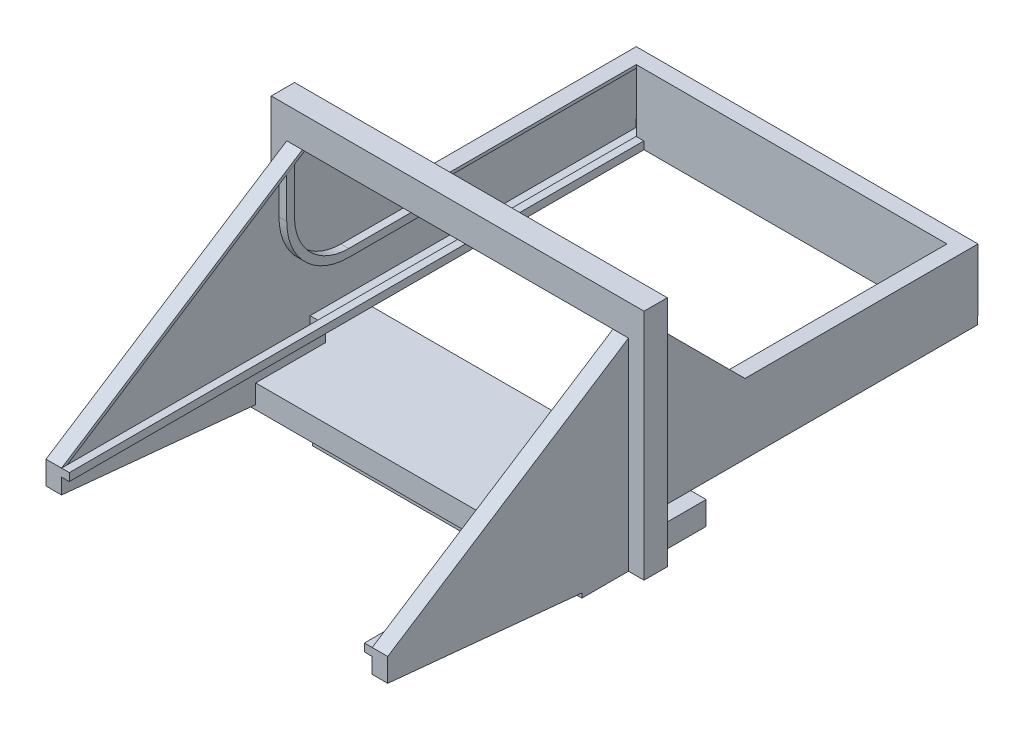
from build123d import *

# Parameters (mm, degrees)
CROQUIS2_W               = 15
CROQUIS2_H               = 150
SALIENTE_EXTRUIR1_DEPTH  = 10
SALIENTE_EXTRUIR2_DEPTH  = 10
CROQUIS5_W               = 15
CROQUIS5_H               = 15
CROQUIS5_H_2             = 20
CROQUIS5_W_2             = 10
CROQUIS5_H_3             = 45.004018959
SALIENTE_EXTRUIR3_DEPTH  = 100
CROQUIS6_W               = 369.884378223
CROQUIS6_H               = 5
SALIENTE_EXTRUIR6_DEPTH  = 5
VACIADO1_START           = 12
VACIADO1_OUTLINE_W       = 11
VACIADO1_OUTLINE_H       = 11
VACIADO1_DEPTH           = 8
VACIADO1_START_2         = 20
VACIADO1_2_OUTLINE_W     = 16
VACIADO1_2_OUTLINE_H     = 11
VACIADO1_2_OUTLINE_W_2   = 11
VACIADO1_2_DEPTH         = 98
VACIADO1_3_DEPTH         = 6
VACIADO1_START_3         = 2
VACIADO1_4_OUTLINE_W     = 146
VACIADO1_4_OUTLINE_H     = 11
VACIADO1_4_DEPTH         = 10
VACIADO1_5_OUTLINE_W     = 1
VACIADO1_5_OUTLINE_H     = 365.884378223
VACIADO1_5_DEPTH         = 3
VACIADO1_START_4         = 22
VACIADO1_6_DEPTH         = 96
SALIENTE_EXTRUIR7_DEPTH  = 5
CROQUIS8_W               = 15
CROQUIS8_H               = 150
SALIENTE_EXTRUIR8_DEPTH  = 10
SIMETR_A8_START          = 228
SIMETR_A8_DEPTH          = 2
SIMETR_A8_START_2        = 120
SIMETR_A8_2_OUTLINE_W    = 20
SIMETR_A8_2_OUTLINE_H    = 15
SIMETR_A8_2_OUTLINE_W_2  = 16
SIMETR_A8_2_OUTLINE_H_2  = 11
SIMETR_A8_2_OUTLINE_W_3  = 15
SIMETR_A8_2_OUTLINE_W_4  = 11
SIMETR_A8_2_OUTLINE_W_5  = 45.004018959
SIMETR_A8_2_OUTLINE_H_3  = 10
SIMETR_A8_2_OUTLINE_W_6  = 41.004018959
SIMETR_A8_2_OUTLINE_H_4  = 6
SIMETR_A8_2_DEPTH        = 100
SIMETR_A8_START_3        = 230
SIMETR_A8_3_OUTLINE_W    = 150
SIMETR_A8_3_OUTLINE_H    = 15
SIMETR_A8_3_DEPTH        = 10
SIMETR_A8_START_4        = 220
SIMETR_A8_4_DEPTH        = 8
SIMETR_A8_START_5        = 215
SIMETR_A8_5_OUTLINE_W    = 5
SIMETR_A8_5_OUTLINE_H    = 369.884378223
SIMETR_A8_5_OUTLINE_W_2  = 1
SIMETR_A8_5_OUTLINE_H_2  = 365.884378223
SIMETR_A8_5_DEPTH        = 5
SIMETR_A8_6_DEPTH        = 2
SIMETR_A8_7_OUTLINE_W    = 16
SIMETR_A8_7_OUTLINE_H    = 11
SIMETR_A8_7_OUTLINE_W_2  = 11
SIMETR_A8_7_OUTLINE_W_3  = 41.004018959
SIMETR_A8_7_OUTLINE_H_2  = 6
SIMETR_A8_7_DEPTH        = 2
SIMETR_A8_8_OUTLINE_W    = 1
SIMETR_A8_8_OUTLINE_H    = 365.884378223
SIMETR_A8_8_DEPTH        = 2
SIMETR_A8_START_6        = 218
SIMETR_A8_9_DEPTH        = 2
SALIENTE_EXTRUIR9_DEPTH  = 5
CROQUIS10_W              = 220
CROQUIS10_H              = 80
SALIENTE_EXTRUIR10_DEPTH = 15
CROQUIS11_W              = 7
CROQUIS11_H              = 1
SALIENTE_EXTRUIR11_DEPTH = 7
CROQUIS12_R              = 2.5
CORTAR_EXTRUIR1_DEPTH    = 351.399583266
CROQUIS13_W              = 137.06677635
CROQUIS13_H              = 7
SALIENTE_EXTRUIR13_DEPTH = 1
CROQUIS14_W              = 136.928381549
CROQUIS14_H              = 7
SALIENTE_EXTRUIR14_DEPTH = 1
CROQUIS15_W              = 144.06677635
CROQUIS15_H              = 1
SALIENTE_EXTRUIR15_DEPTH = 7


# Read off the part's stored shape, not the designer's step: Vaciado1, Simetría8
with BuildPart() as part:
    # Croquis2 → Saliente-Extruir1 (new body)
    with BuildSketch(Plane(origin=(0, 0, 0), x_dir=(0, 0, -1), z_dir=(1, 0, 0))):
        Rectangle(CROQUIS2_W, CROQUIS2_H)
    extrude(amount=SALIENTE_EXTRUIR1_DEPTH)

    # Croquis3 → Saliente-Extruir2 (add)
    with BuildSketch(Plane(origin=(10, 0, 0), x_dir=(0, 0, -1), z_dir=(1, 0, 0))):
        Polygon((-7.5, -75), (-162.5, -60), (-162.5, -45), (-7.5, 55), (-7.5, 75), (7.5, 75), (7.5, 55), (67.5, -5), (217.5, -5), (217.5, -45), (217.230368445, -45), (217.230368445, -50), (7.5, -50), (7.5, -75), align=None)
    extrude(amount=SALIENTE_EXTRUIR2_DEPTH)

    # Croquis5 → Saliente-Extruir3 (add)
    with BuildSketch(Plane(origin=(20, 0, 0), x_dir=(0, 0, -1), z_dir=(1, 0, 0))):
        with Locations((0, -67.5)):
            Rectangle(CROQUIS5_W, CROQUIS5_H)
        with Locations((0, 65)):
            Rectangle(CROQUIS5_W, CROQUIS5_H_2)
        with Locations((212.5, -27.502009479)):
            Rectangle(CROQUIS5_W_2, CROQUIS5_H_3)
    extrude(amount=SALIENTE_EXTRUIR3_DEPTH)

    # Croquis6 → Saliente-Extruir6 (add)
    with BuildSketch(Plane(origin=(20, 0, 0), x_dir=(0, 0, -1), z_dir=(1, 0, 0))):
        with Locations((22.442189111, -47.5)):
            Rectangle(CROQUIS6_W, CROQUIS6_H)
    extrude(amount=SALIENTE_EXTRUIR6_DEPTH)

    # Vaciado1 outline → Vaciado1 (cut)
    with BuildSketch(Plane.YZ.offset(VACIADO1_START)):
        Polygon((73, -5.5), (73, 5.5), (53.910210742, 5.5), (-46.089789258, 160.5), (-48, 160.5), (-48, -215.230368445), (-43, -215.230368445), (-43, -215.5), (-7, -215.5), (-7, -66.671572875), (54.171572875, -5.5), align=None)
        with Locations((-67.5, 0)):
            Rectangle(VACIADO1_OUTLINE_W, VACIADO1_OUTLINE_H)
    extrude(amount=VACIADO1_DEPTH, mode=Mode.SUBTRACT)

    # Vaciado1 2 outline → Vaciado1 2 (cut)
    with BuildSketch(Plane.YZ.offset(VACIADO1_START_2)):
        with Locations((65, 0)):
            Rectangle(VACIADO1_2_OUTLINE_W, VACIADO1_2_OUTLINE_H)
        Polygon((-7, -215.5), (-7, -209.5), (-48, -209.5), (-48, -215.230368445), (-43, -215.230368445), (-43, -215.5), align=None)
        with Locations((-67.5, 0)):
            Rectangle(VACIADO1_2_OUTLINE_W_2, VACIADO1_2_OUTLINE_H)
    extrude(amount=VACIADO1_2_DEPTH, mode=Mode.SUBTRACT)

    # Vaciado1 3 outline → Vaciado1 3 (cut)
    with BuildSketch(Plane.YZ.offset(VACIADO1_START)):
        Polygon((-62, -5.5), (-48, -5.5), (-48, 160.5), (-58.184204967, 160.5), (-73, 7.40345133), (-73, 5.5), (-62, 5.5), align=None)
    extrude(amount=VACIADO1_3_DEPTH, mode=Mode.SUBTRACT)

    # Vaciado1 4 outline → Vaciado1 4 (cut)
    with BuildSketch(Plane.YZ.offset(VACIADO1_START_3)):
        Rectangle(VACIADO1_4_OUTLINE_W, VACIADO1_4_OUTLINE_H)
    extrude(amount=VACIADO1_4_DEPTH, mode=Mode.SUBTRACT)

    # Vaciado1 5 outline → Vaciado1 5 (cut)
    with BuildSketch(Plane.YZ.offset(VACIADO1_START_2)):
        with Locations((-47.5, -22.442189111)):
            Rectangle(VACIADO1_5_OUTLINE_W, VACIADO1_5_OUTLINE_H)
    extrude(amount=VACIADO1_5_DEPTH, mode=Mode.SUBTRACT)

    # Vaciado1 6 outline → Vaciado1 6 (cut)
    with BuildSketch(Plane.YZ.offset(VACIADO1_START_4)):
        Polygon((-48, -215.230368445), (-48, -209.5), (-48.004018959, -209.5), (-48.004018959, -215.5), (-43, -215.5), (-43, -215.230368445), align=None)
    extrude(amount=VACIADO1_6_DEPTH, mode=Mode.SUBTRACT)

    # Croquis8 → Saliente-Extruir8 (add)
    with BuildSketch(Plane(origin=(12, 0, 0), x_dir=(0, 0, -1), z_dir=(1, 0, 0))):
        Rectangle(CROQUIS8_W, CROQUIS8_H)
    extrude(amount=-SALIENTE_EXTRUIR8_DEPTH)

    # Simetr_a8 2 outline → Simetr_a8 2 (add)
    # profile 1 of 3: a face of its own
    with BuildSketch(Plane.YZ.offset(SIMETR_A8_START_2)):
        with Locations((65, 0)):
            Rectangle(SIMETR_A8_2_OUTLINE_W, SIMETR_A8_2_OUTLINE_H)
        with Locations((65, 0)):
            Rectangle(SIMETR_A8_2_OUTLINE_W_2, SIMETR_A8_2_OUTLINE_H_2, mode=Mode.SUBTRACT)
    # profile 2 of 3: a face of its own
    with BuildSketch(Plane.YZ.offset(SIMETR_A8_START_2)):
        with Locations((-67.5, 0)):
            Rectangle(SIMETR_A8_2_OUTLINE_W_3, SIMETR_A8_2_OUTLINE_H)
        with Locations((-67.5, 0)):
            Rectangle(SIMETR_A8_2_OUTLINE_W_4, SIMETR_A8_2_OUTLINE_H_2, mode=Mode.SUBTRACT)
    # profile 3 of 3: a face of its own
    with BuildSketch(Plane.YZ.offset(SIMETR_A8_START_2)):
        with Locations((-27.502009479, -212.5)):
            Rectangle(SIMETR_A8_2_OUTLINE_W_5, SIMETR_A8_2_OUTLINE_H_3)
        with Locations((-27.502009479, -212.5)):
            Rectangle(SIMETR_A8_2_OUTLINE_W_6, SIMETR_A8_2_OUTLINE_H_4, mode=Mode.SUBTRACT)
    extrude(amount=SIMETR_A8_2_DEPTH)



with BuildPart() as body_2:
    # Croquis7 → Saliente-Extruir7 (new body)
    with BuildSketch(Plane(origin=(20, 0, 0), x_dir=(0, 0, -1), z_dir=(1, 0, 0))):
        with BuildLine():
            Line((-17.511578112, 20), (-17.511578112, 48.540917347))
            Line((-17.511578112, 48.540917347), (-12.511578112, 51.766723799))
            Line((-12.511578112, 51.766723799), (-12.511578112, 20))
            ThreePointArc((-12.511578112, 20), (-2.276657661, -4.732396988), (22.442189111, -15))
            Line((22.442189111, -15), (67.5, -15))
            Line((67.5, -15), (67.5, -20))
            Line((67.5, -20), (22.488421888, -20))
            ThreePointArc((22.488421888, -20), (-5.795849359, -8.284271247), (-17.511578112, 20))
        make_face()
    extrude(amount=-SALIENTE_EXTRUIR7_DEPTH)


with BuildPart() as body_3:
    # Simetría8 outline → Simetría8 (new body)
    with BuildSketch(Plane.YZ.offset(SIMETR_A8_START)):
        Polygon((-45, 162.5), (-60, 162.5), (-75, 7.5), (-75, -7.5), (-50, -7.5), (-50, -217.230368445), (-45, -217.230368445), (-45, -217.5), (-5, -217.5), (-5, -67.5), (55, -7.5), (75, -7.5), (75, 7.5), (55, 7.5), align=None)
    extrude(amount=SIMETR_A8_DEPTH)

    # Simetr_a8 3 outline → Simetr_a8 3 (add)
    with BuildSketch(Plane.YZ.offset(SIMETR_A8_START_3)):
        Rectangle(SIMETR_A8_3_OUTLINE_W, SIMETR_A8_3_OUTLINE_H)
    extrude(amount=SIMETR_A8_3_DEPTH)


with BuildPart() as part_1:
    add(part.part)

    add(body_3.part)  # Simetr_a8 4 merges body 3
    # Simetr_a8 4 outline → Simetr_a8 4 (add)
    with BuildSketch(Plane.YZ.offset(SIMETR_A8_START_4)):
        Polygon((-45, 162.5), (-60, 162.5), (-75, 7.5), (-75, -7.5), (-50, -7.5), (-50, -217.230368445), (-45, -217.230368445), (-45, -217.5), (-5, -217.5), (-5, -67.5), (55, -7.5), (75, -7.5), (75, 7.5), (55, 7.5), align=None)
        Polygon((-46.089789258, 160.5), (53.910210742, 5.5), (73, 5.5), (73, -5.5), (54.171572875, -5.5), (-7, -66.671572875), (-7, -215.5), (-43, -215.5), (-43, -215.230368445), (-48, -215.230368445), (-48, -5.5), (-73, -5.5), (-73, 7.40345133), (-58.184204967, 160.5), align=None, mode=Mode.SUBTRACT)
    extrude(amount=SIMETR_A8_4_DEPTH)

    # Simetr_a8 5 outline → Simetr_a8 5 (add)
    with BuildSketch(Plane.YZ.offset(SIMETR_A8_START_5)):
        with Locations((-47.5, -22.442189111)):
            Rectangle(SIMETR_A8_5_OUTLINE_W, SIMETR_A8_5_OUTLINE_H)
        with Locations((-47.5, -22.442189111)):
            Rectangle(SIMETR_A8_5_OUTLINE_W_2, SIMETR_A8_5_OUTLINE_H_2, mode=Mode.SUBTRACT)
    extrude(amount=SIMETR_A8_5_DEPTH)

    # Simetr_a8 6 outline → Simetr_a8 6 (add)
    with BuildSketch(Plane.YZ.offset(SIMETR_A8_START_4)):
        Polygon((-48, 160.5), (-58.184204967, 160.5), (-73, 7.40345133), (-73, 5.5), (-62, 5.5), (-62, -5.5), (-48, -5.5), align=None)
    extrude(amount=SIMETR_A8_6_DEPTH)

    # Simetr_a8 7 outline → Simetr_a8 7 (add)
    with BuildSketch(Plane.YZ.offset(SIMETR_A8_START_2)):
        with Locations((65, 0)):
            Rectangle(SIMETR_A8_7_OUTLINE_W, SIMETR_A8_7_OUTLINE_H)
        with Locations((-67.5, 0)):
            Rectangle(SIMETR_A8_7_OUTLINE_W_2, SIMETR_A8_7_OUTLINE_H)
        with Locations((-27.502009479, -212.5)):
            Rectangle(SIMETR_A8_7_OUTLINE_W_3, SIMETR_A8_7_OUTLINE_H_2)
    extrude(amount=SIMETR_A8_7_DEPTH)

    # Simetr_a8 8 outline → Simetr_a8 8 (add)
    with BuildSketch(Plane.YZ.offset(SIMETR_A8_START_5)):
        with Locations((-47.5, -22.442189111)):
            Rectangle(SIMETR_A8_8_OUTLINE_W, SIMETR_A8_8_OUTLINE_H)
    extrude(amount=SIMETR_A8_8_DEPTH)

    # Simetr_a8 9 outline → Simetr_a8 9 (add)
    with BuildSketch(Plane.YZ.offset(SIMETR_A8_START_6)):
        Polygon((-48, -215.230368445), (-48, -209.5), (-48.004018959, -209.5), (-48.004018959, -215.5), (-43, -215.5), (-43, -215.230368445), align=None)
    extrude(amount=SIMETR_A8_9_DEPTH)

    # Croquis9 → Saliente-Extruir9 (add)
    with BuildSketch(Plane.ZY.offset(-228)):
        with BuildLine():
            Line((-67.5, -25), (-22.49, -25))
            ThreePointArc((-22.49, -25), (5.794271247, -13.284271247), (17.51, 15))
            Line((17.51, 15), (17.511578112, 48.540917347))
            Line((17.511578112, 48.540917347), (12.51, 51.767741935))
            Line((12.51, 51.767741935), (12.51, 15))
            ThreePointArc((12.51, 15), (2.258737342, -9.748737342), (-22.49, -20))
            Line((-22.49, -20), (-67.5, -20))
            Line((-67.5, -20), (-67.5, -25))
        make_face()
    extrude(amount=SALIENTE_EXTRUIR9_DEPTH)

    # Croquis10 → Saliente-Extruir10 (add)
    with BuildSketch(Plane.XZ.offset(75)):
        with Locations((120, -2.5)):
            Rectangle(CROQUIS10_W, CROQUIS10_H)
    extrude(amount=-SALIENTE_EXTRUIR10_DEPTH)

    # Croquis11 → Saliente-Extruir11 (add)
    with BuildSketch(Plane.XZ.offset(75)):
        Polygon((58.295818619, -36.723516543), (54.795818619, -36.723516543), (51.295818619, -36.723516543), (51.295818619, -37.723516543), (58.295818619, -37.723516543), align=None)
        Polygon((51.295818619, 23.276483457), (54.795818619, 23.276483457), (58.295818619, 23.276483457), (58.295818619, 24.276483457), (51.295818619, 24.276483457), align=None)
        with Locations((184.795818619, 23.776483457)):
            Rectangle(CROQUIS11_W, CROQUIS11_H)
        with Locations((184.795818619, -37.223516543)):
            Rectangle(CROQUIS11_W, CROQUIS11_H)
    extrude(amount=SALIENTE_EXTRUIR11_DEPTH)

    # Croquis12 → Cortar-Extruir1 (cut, through all)
    with BuildSketch(Plane.XY.offset(24.276483457)):
        with Locations((54.795818619, -78.5)):
            Circle(CROQUIS12_R)
        with Locations((184.795818619, -78.5)):
            Circle(CROQUIS12_R)
    extrude(amount=-CORTAR_EXTRUIR1_DEPTH, mode=Mode.SUBTRACT)

    # Croquis13 → Saliente-Extruir13 (add)
    with BuildSketch(Plane(origin=(0, 0, -37.723516543), x_dir=(-1, 0, 0), z_dir=(0, 0, -1))):
        with Locations((-126.829206794, -78.5)):
            Rectangle(CROQUIS13_W, CROQUIS13_H)
    extrude(amount=-SALIENTE_EXTRUIR13_DEPTH)

    # Croquis14 → Saliente-Extruir14 (add)
    with BuildSketch(Plane.XY.offset(24.276483457)):
        with Locations((126.898404195, -78.5)):
            Rectangle(CROQUIS14_W, CROQUIS14_H)
    extrude(amount=-SALIENTE_EXTRUIR14_DEPTH)

    # Croquis15 → Saliente-Extruir15 (add)
    with BuildSketch(Plane.XZ.offset(75)):
        with Locations((123.329206794, 31.776483457)):
            Rectangle(CROQUIS15_W, CROQUIS15_H)
    extrude(amount=SALIENTE_EXTRUIR15_DEPTH)


solid = Compound([body_2.part, part_1.part])
